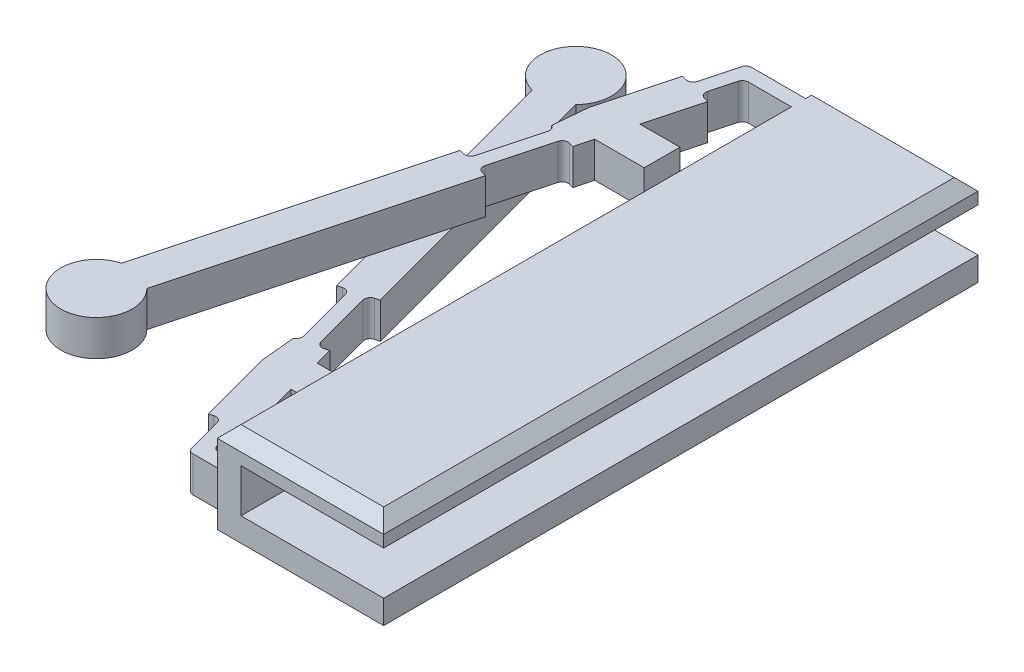
from build123d import *

# Parameters (mm, degrees)
BOSS_EXTRUDE1_DEPTH = 50
BOSS_EXTRUDE2_DEPTH = 3
CIRPATTERN1_COUNT   = 2
CHAMFER1_SIZE       = 1
FILLET1_R           = 0.5
CHAMFER2_START      = -1
CHAMFER2_DEPTH      = 10


with BuildPart() as part:
    # Sketch2 → Boss-Extrude1 (new body)
    with BuildSketch(Plane.XY):
        Polygon((0, 0), (0, 7.65), (14, 7.65), (14, 5.65), (2, 5.65), (2, 2), (14, 2), (14, 0), align=None)
    extrude(amount=BOSS_EXTRUDE1_DEPTH)

    # Sketch3 → Boss-Extrude2 (add)
    with BuildSketch(Plane(origin=(0, 7.65, 0), x_dir=(1, 0, 0), z_dir=(0, 1, 0))):
        with BuildLine():
            Line((0, -2.7), (0, -1.5))
            Line((0, -1.5), (-3.920792386, -1.5))
            Line((-3.920792386, -1.5), (-4.935568127, -5.287194625))
            Line((-4.935568127, -5.287194625), (-5.804901371, -5.054257484))
            Line((-5.804901371, -5.054257484), (-8.202748881, -14.003146224))
            Line((-8.202748881, -14.003146224), (-7.333415638, -14.236083364))
            Line((-7.333415638, -14.236083364), (-8.886329908, -20.031638322))
            Line((-8.886329908, -20.031638322), (-9.755663152, -19.798701181))
            Line((-9.755663152, -19.798701181), (-15.776457135, -42.268610229))
            ThreePointArc((-15.776457135, -42.268610229), (-15.776457135, -48.064165187), (-12.878679656, -43.045067364))
            Line((-12.878679656, -43.045067364), (-6.857885673, -20.575158317))
            Line((-6.857885673, -20.575158317), (-7.727218917, -20.342221176))
            Line((-7.727218917, -20.342221176), (-6.174304646, -14.546666218))
            Line((-6.174304646, -14.546666218), (-5.304971403, -14.779603359))
            Line((-5.304971403, -14.779603359), (-4.916742835, -13.330714619))
            Line((-4.916742835, -13.330714619), (-0.75, -13.330714619))
            Line((-0.75, -13.330714619), (-0.75, -10.330714619))
            Line((-0.75, -10.330714619), (-4.112895258, -10.330714619))
            Line((-4.112895258, -10.330714619), (-2.907123892, -5.830714619))
            Line((-2.907123892, -5.830714619), (-3.776457135, -5.597777479))
            Line((-3.776457135, -5.597777479), (-3, -2.7))
            Line((-3, -2.7), (0, -2.7))
        make_face()
    boss_extrude2 = extrude(amount=-BOSS_EXTRUDE2_DEPTH)

    # CirPattern1: Boss-Extrude2 ×2 about axis
    cirpattern1_axis = Axis((0, 3.825, 25), (1, 0, 0))
    for i in range(1, CIRPATTERN1_COUNT):
        add(boss_extrude2.rotate(cirpattern1_axis, i * 360 / CIRPATTERN1_COUNT))

    # Chamfer1
    chamfer1_edges = [part.edges().sort_by_distance(p)[0] for p in [
        (0, 7.65, 26.35),
        (14, 7.65, 25),
        (0, 7.65, 0.75),
        (7, 7.65, 50),
        (7, 7.65, 0),
    ]]
    chamfer(chamfer1_edges, length=CHAMFER1_SIZE)

    # Fillet1
    fillet1_edges = [part.edges().sort_by_distance(p)[0] for p in [
        (-8.886329908, 6.15, 20.031638322),
        (-7.333415638, 6.15, 14.236083364),
        (-4.935568127, 6.15, 5.287194625),
        (-3.920792386, 6.15, 1.5),
        (0, 5.65, 1.5),
        (0, 5.65, 2.7),
        (-3, 6.15, 2.7),
        (-3.776457135, 6.15, 5.597777479),
        (-6.174304646, 6.15, 14.546666218),
        (-7.727218917, 6.15, 20.342221176),
        (-8.886329908, 1.5, 29.968361678),
        (-7.333415638, 1.5, 35.763916636),
        (-4.935568127, 1.5, 44.712805375),
        (-3.920792386, 1.5, 48.5),
        (0, 1.5, 48.5),
        (0, 1.5, 47.3),
        (-3, 1.5, 47.3),
        (-3.776457135, 1.5, 44.402222521),
        (-6.174304646, 1.5, 35.453333782),
        (-7.727218917, 1.5, 29.657778824),
    ]]
    fillet(fillet1_edges, radius=FILLET1_R)

    # Chamfer2: read off the stored shape, not the designer's step
    # Chamfer2 outline → Chamfer2 (cut)
    with BuildSketch(Plane(origin=(0, 0, 0), x_dir=(1, 0, 0), z_dir=(0, 1, 0)).offset(CHAMFER2_START)):
        with BuildLine():
            Line((-7.464876997, -38.750629138), (-7.733281129, -35.862956659))
            ThreePointArc((-7.733281129, -35.862956659), (-7.7741568, -35.879982991), (-7.816378551, -35.893326158))
            Line((-7.816378551, -35.893326158), (-8.202748881, -35.996853776))
            Line((-8.202748881, -35.996853776), (-7.464876997, -38.750629138))
        make_face()
        with BuildLine():
            Line((-7.733281129, -14.137043341), (-7.464876997, -11.249370862))
            Line((-7.464876997, -11.249370862), (-8.202748881, -14.003146224))
            Line((-8.202748881, -14.003146224), (-7.816378551, -14.106673842))
            ThreePointArc((-7.816378551, -14.106673842), (-7.7741568, -14.120017009), (-7.733281129, -14.137043341))
        make_face()
    extrude(amount=CHAMFER2_DEPTH, mode=Mode.SUBTRACT)


solid = part.part
